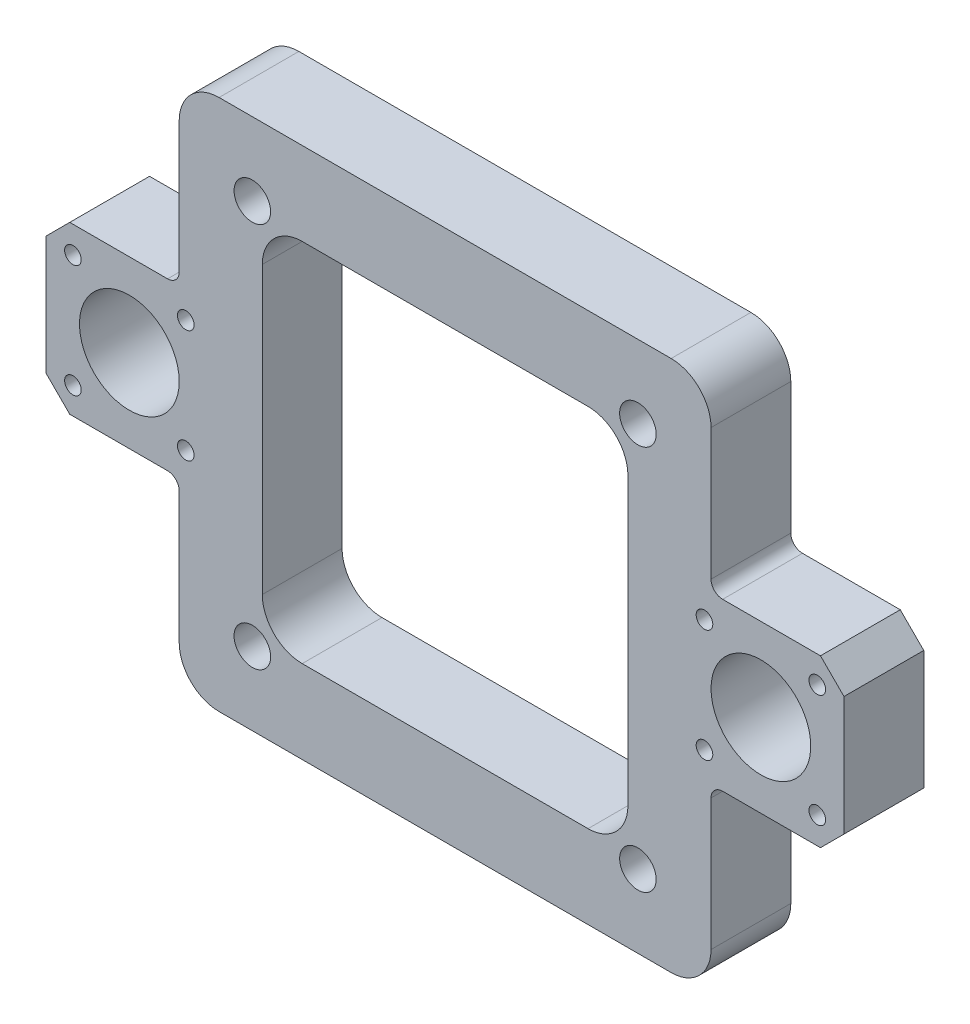
from build123d import *

# Parameters (mm, degrees)
SKETCH1_R                   = 7.5
SKETCH1_R_2                 = 2.75
BOSS_EXTRUDE1_DEPTH         = 12
CUT_EXTRUDE1_DEPTH          = 74.10266753
CUT_EXTRUDE1_DEPTH_BACK     = 74.10266753
TAP_DRILL_FOR_M3X0_5_TAP1_D = 2.5


with BuildPart() as part:
    # Sketch1 → Boss-Extrude1 (new body)
    with BuildSketch(Plane.XY):
        with BuildLine():
            Line((-56.464466094, 12.5), (-41.75, 12.5))
            ThreePointArc((-41.75, 12.5), (-40.512563133, 13.012563133), (-40, 14.25))
            Line((-40, 14.25), (-40, 34))
            ThreePointArc((-40, 34), (-38.242640687, 38.242640687), (-34, 40))
            Line((-34, 40), (34, 40))
            ThreePointArc((34, 40), (38.242640687, 38.242640687), (40, 34))
            Line((40, 34), (40, 14.25))
            ThreePointArc((40, 14.25), (40.512563133, 13.012563133), (41.75, 12.5))
            Line((41.75, 12.5), (56.464466094, 12.5))
            Line((56.464466094, 12.5), (60, 8.964466094))
            Line((60, 8.964466094), (60, -8.964466094))
            Line((60, -8.964466094), (56.464466094, -12.5))
            Line((56.464466094, -12.5), (41.75, -12.5))
            ThreePointArc((41.75, -12.5), (40.512563133, -13.012563133), (40, -14.25))
            Line((40, -14.25), (40, -34))
            ThreePointArc((40, -34), (38.242640687, -38.242640687), (34, -40))
            Line((34, -40), (-34, -40))
            ThreePointArc((-34, -40), (-38.242640687, -38.242640687), (-40, -34))
            Line((-40, -34), (-40, -14.25))
            ThreePointArc((-40, -14.25), (-40.512563133, -13.012563133), (-41.75, -12.5))
            Line((-41.75, -12.5), (-56.464466094, -12.5))
            Line((-56.464466094, -12.5), (-60, -8.964466094))
            Line((-60, -8.964466094), (-60, 8.964466094))
            Line((-60, 8.964466094), (-56.464466094, 12.5))
        make_face()
        with Locations((-47.5, 0)):
            Circle(SKETCH1_R, mode=Mode.SUBTRACT)
        with Locations((47.5, 0)):
            Circle(SKETCH1_R, mode=Mode.SUBTRACT)
        with Locations((-29, 29)):
            Circle(SKETCH1_R_2, mode=Mode.SUBTRACT)
        with Locations((29, 29)):
            Circle(SKETCH1_R_2, mode=Mode.SUBTRACT)
        with Locations((29, -29)):
            Circle(SKETCH1_R_2, mode=Mode.SUBTRACT)
        with Locations((-29, -29)):
            Circle(SKETCH1_R_2, mode=Mode.SUBTRACT)
    extrude(amount=BOSS_EXTRUDE1_DEPTH)

    # Sketch2 → Cut-Extrude1 (cut, two sides: drawn at the far end of the back side and taken through both)
    with BuildSketch(Plane.XY.offset(12).offset(-CUT_EXTRUDE1_DEPTH_BACK)):
        with BuildLine():
            Line((-21.5, 27.5), (21.5, 27.5))
            ThreePointArc((21.5, 27.5), (25.742640687, 25.742640687), (27.5, 21.5))
            Line((27.5, 21.5), (27.5, -21.5))
            ThreePointArc((27.5, -21.5), (25.742640687, -25.742640687), (21.5, -27.5))
            Line((21.5, -27.5), (-21.5, -27.5))
            ThreePointArc((-21.5, -27.5), (-25.742640687, -25.742640687), (-27.5, -21.5))
            Line((-27.5, -21.5), (-27.5, 21.5))
            ThreePointArc((-27.5, 21.5), (-25.742640687, 25.742640687), (-21.5, 27.5))
        make_face()
    extrude(amount=CUT_EXTRUDE1_DEPTH + CUT_EXTRUDE1_DEPTH_BACK, mode=Mode.SUBTRACT)

    # Tap Drill for M3x0.5 Tap1 (through all)
    with Locations(Plane(origin=(0, 0, 0), x_dir=(-1, 0, 0), z_dir=(0, 0, -1))):
        with Locations((55.985281374, -8.485281374), (55.985281374, 8.485281374), (39.014718626, 8.485281374), (39.014718626, -8.485281374), (-39.014718626, -8.485281374), (-39.014718626, 8.485281374), (-55.985281374, 8.485281374), (-55.985281374, -8.485281374)):
            Hole(TAP_DRILL_FOR_M3X0_5_TAP1_D / 2)


solid = part.part
